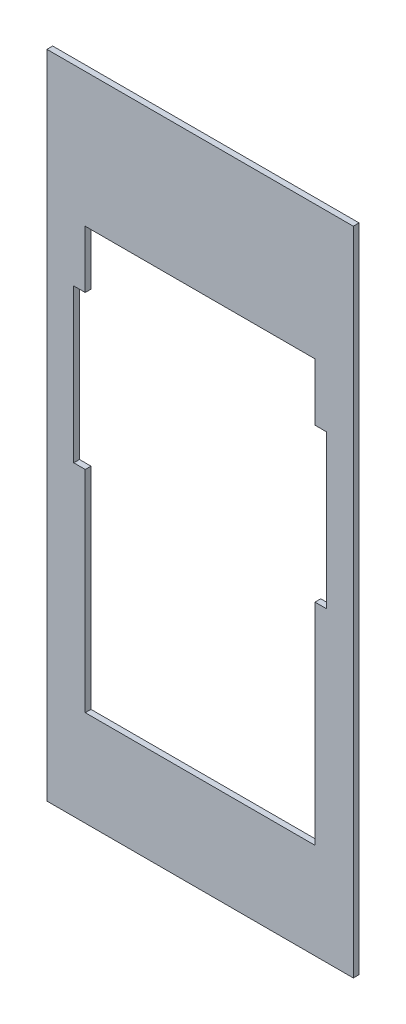
from build123d import *

# Parameters (mm, degrees)
SKETCH1_W           = 80
SKETCH1_H           = 170
BOSS_EXTRUDE1_DEPTH = 1.5


with BuildPart() as part:
    # Sketch1 → Boss-Extrude1 (new body)
    with BuildSketch(Plane.XY):
        Rectangle(SKETCH1_W, SKETCH1_H)
        Polygon((30, 50), (-30, 50), (-30, 35), (-33, 35), (-33, -5), (-30, -5), (-30, -60), (30, -60), (30, -5), (33, -5), (33, 35), (30, 35), align=None, mode=Mode.SUBTRACT)
    extrude(amount=BOSS_EXTRUDE1_DEPTH)


solid = part.part
